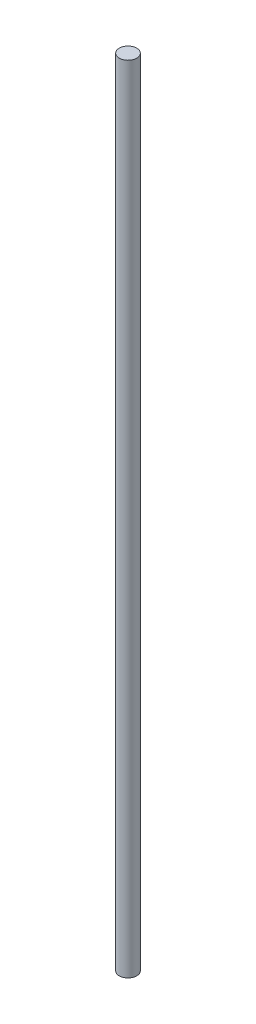
from build123d import *

# Parameters (mm, degrees)
SKETCH1_R           = 3
BOSS_EXTRUDE1_DEPTH = 273


with BuildPart() as part:
    # Sketch1 → Boss-Extrude1 (new body)
    with BuildSketch(Plane(origin=(0, 0, 0), x_dir=(1, 0, 0), z_dir=(0, 1, 0))):
        Circle(SKETCH1_R)
    extrude(amount=BOSS_EXTRUDE1_DEPTH)


solid = part.part
